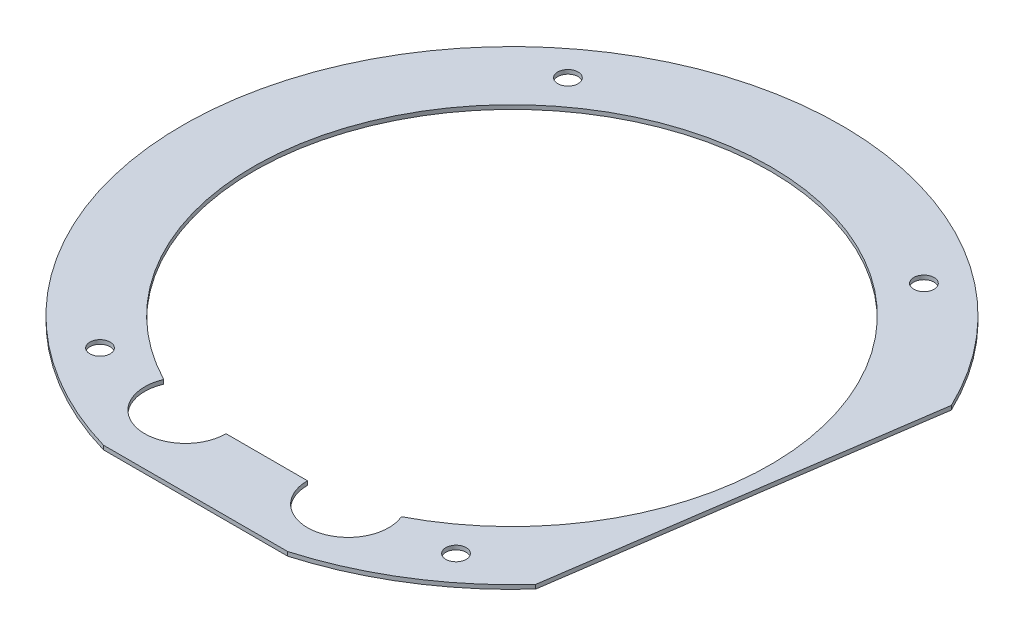
from build123d import *

# Parameters (mm, degrees)
SKETCH1_R           = 1
BOSS_EXTRUDE1_DEPTH = 0.4


with BuildPart() as part:
    # Sketch1 → Boss-Extrude1 (new body)
    with BuildSketch(Plane(origin=(0, 0, 0), x_dir=(1, 0, 0), z_dir=(0, 1, 0))):
        with BuildLine():
            Line((29.237843605, 13.960963482), (24.049079653, -21.711788683))
            ThreePointArc((24.049079653, -21.711788683), (17.208573183, -27.452231403), (9.060814288, -31.107260317))
            Line((9.060814288, -31.107260317), (-9.060814288, -31.107260317))
            ThreePointArc((-9.060814288, -31.107260317), (-24.689356555, 20.980840614), (29.237843605, 13.960963482))
        make_face()
        with Locations((-17.5, 23)):
            Circle(SKETCH1_R, mode=Mode.SUBTRACT)
        with Locations((-17.5, -23)):
            Circle(SKETCH1_R, mode=Mode.SUBTRACT)
        with Locations((17.5, -23)):
            Circle(SKETCH1_R, mode=Mode.SUBTRACT)
        with Locations((17.5, 23)):
            Circle(SKETCH1_R, mode=Mode.SUBTRACT)
        with BuildLine():
            Line((-4, -24.107260317), (4, -24.107260317))
            ThreePointArc((4, -24.107260317), (8.793181532, -28.027829543), (11.685431528, -22.552398764))
            ThreePointArc((11.685431528, -22.552398764), (0, 25.4), (-11.685431528, -22.552398764))
            ThreePointArc((-11.685431528, -22.552398764), (-8.793181532, -28.027829543), (-4, -24.107260317))
        make_face(mode=Mode.SUBTRACT)
    extrude(amount=BOSS_EXTRUDE1_DEPTH)


solid = part.part
